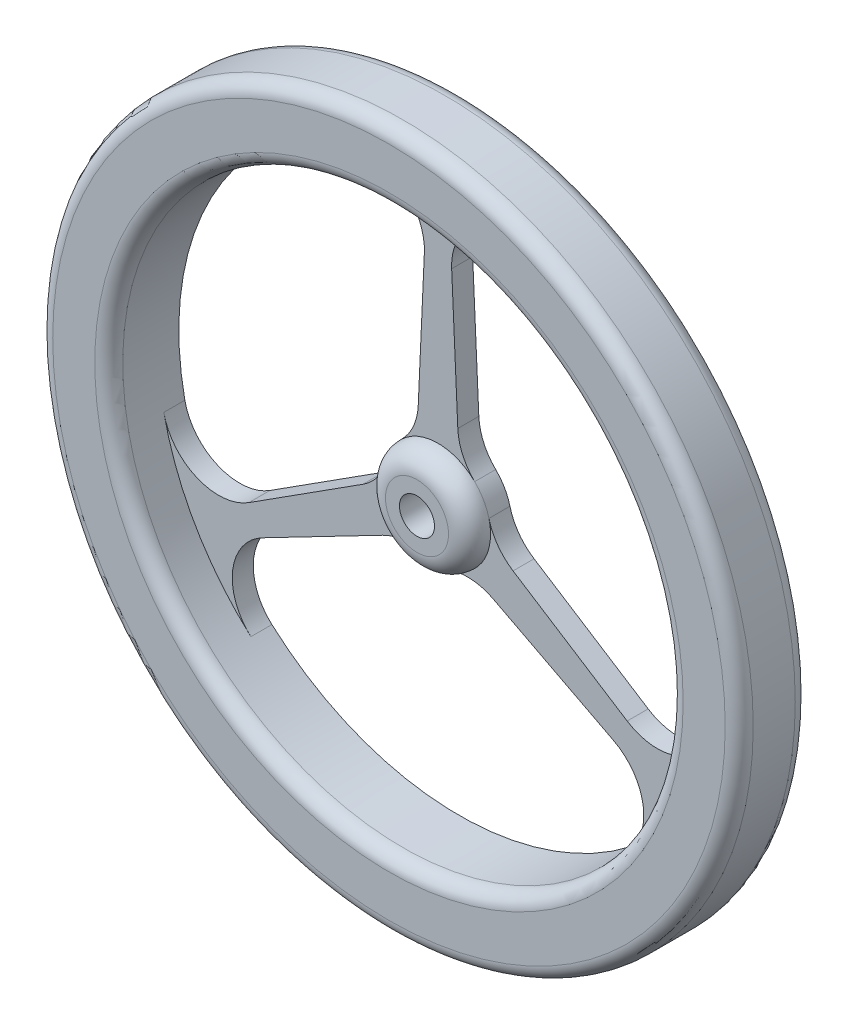
from build123d import *

# Parameters (mm, degrees)
SKETCH1_R           = 50
SKETCH1_R_2         = 40
EXTRUDE_THIN1_DEPTH = 10
SKETCH2_R           = 7.5
SKETCH2_R_2         = 2.5
BOSS_EXTRUDE1_DEPTH = 6
BOSS_EXTRUDE4_DEPTH = 3
FILLET4_R           = 8
FILLET2_R           = 3
FILLET3_R           = 2


# Some blends are built 0.0001 mm under size
with BuildPart() as part:
    # Sketch1 → Extrude-Thin1 (new body)
    with BuildSketch(Plane.XY):
        Circle(SKETCH1_R)
        Circle(SKETCH1_R_2, mode=Mode.SUBTRACT)
    extrude(amount=EXTRUDE_THIN1_DEPTH)



with BuildPart() as body_2:
    # Sketch2 → Boss-Extrude1 (new body)
    with BuildSketch(Plane.XY):
        Circle(SKETCH2_R)
        Circle(SKETCH2_R_2, mode=Mode.SUBTRACT)
    extrude(amount=BOSS_EXTRUDE1_DEPTH)


with BuildPart() as part_1:
    add(part.part)

    add(body_2.part)  # Boss-Extrude4 merges body 2
    # Sketch3 → Boss-Extrude4 (add)
    with BuildSketch(Plane.XY):
        with BuildLine():
            ThreePointArc((-3, 6.873863542), (-1.532322328, 7.341797347), (0, 7.5))
            Line((0, 7.5), (0, 40))
            ThreePointArc((0, 40), (-0.75, 39.992968132), (-1.499736305, 39.971875))
            Line((-1.499736305, 39.971875), (-3, 6.873863542))
        make_face()
        with BuildLine():
            Line((0, 40), (0, 7.5))
            ThreePointArc((0, 7.5), (1.532322328, 7.341797347), (3, 6.873863542))
            Line((3, 6.873863542), (1.499736305, 39.971875))
            ThreePointArc((1.499736305, 39.971875), (0.75, 39.992968132), (0, 40))
        make_face()
        with BuildLine():
            Line((4.45294045, -6.035007983), (33.866791034, -21.284747239))
            ThreePointArc((33.866791034, -21.284747239), (34.641016151, -20), (35.366527339, -18.687127761))
            Line((35.366527339, -18.687127761), (7.45294045, -0.83885556))
            ThreePointArc((7.45294045, -0.83885556), (6.495190528, -3.75), (4.45294045, -6.035007983))
        make_face()
        with BuildLine():
            ThreePointArc((-35.366527339, -18.687127761), (-34.641016151, -20), (-33.866791034, -21.284747239))
            Line((-33.866791034, -21.284747239), (-4.45294045, -6.035007983))
            ThreePointArc((-4.45294045, -6.035007983), (-6.495190528, -3.75), (-7.45294045, -0.83885556))
            Line((-7.45294045, -0.83885556), (-35.366527339, -18.687127761))
        make_face()
    extrude(amount=BOSS_EXTRUDE4_DEPTH)

    # Fillet4
    # the kernel refuses this fillet: 8 mm, written as the material it adds along each edge
    with BuildSketch(Plane(origin=(-3, 6.873863542, 0), x_dir=(-0.829854636614874, -0.5579796430774114, 0), z_dir=(0, 0, 1)), Plane(origin=(7.45294045, -0.83885556, 0), x_dir=(-0.06829722739215581, 0.9976650182954919, 0), z_dir=(0, 0, 1)), Plane(origin=(-4.45294045, -6.035007983, 0), x_dir=(0.8981518640070405, -0.43968537521809675, 0), z_dir=(0, 0, 1))) as fillet4_piece_1:
        with BuildLine():
            CenterArc((4.127463516, -7.870129559), FILLET4_R, 100.338012957, 43.150474146)
            Line((-2.302435059, -3.110255158), (0, 0))
            ThreePointArc((0, 0), (1.345912016, -0.121753539), (2.691824032, 0))
        make_face()
    extrude(amount=3)
    with BuildSketch(Plane(origin=(3, 6.873863542, 0), x_dir=(0.8298546366148741, -0.5579796430774113, 0), z_dir=(0, 0, 1)), Plane(origin=(4.45294045, -6.035007983, 0), x_dir=(-0.8981518640070573, -0.4396853752180626, 0), z_dir=(0, 0, 1)), Plane(origin=(-7.45294045, -0.83885556, 0), x_dir=(0.06829722739219261, 0.9976650182954894, 0), z_dir=(0, 0, 1))) as fillet4_piece_2:
        with BuildLine():
            CenterArc((4.127463516, 7.870129559), FILLET4_R, 216.511512897, 43.150474146)
            Line((-2.302435059, 3.110255158), (0, 0))
            ThreePointArc((0, 0), (1.345912016, 0.121753539), (2.691824032, 0))
        make_face()
    extrude(amount=3)
    with BuildSketch(Plane(origin=(1.499736305, 39.971875, 0), x_dir=(0.04528141614846467, -0.9989742706154096, 0), z_dir=(0, 0, 1)), Plane(origin=(33.866791034, -21.284747239, 0), x_dir=(-0.8877778041541985, 0.46027227860381686, 0), z_dir=(0, 0, 1)), Plane(origin=(-35.366527339, -18.687127761, 0), x_dir=(0.8424963880057403, 0.5387019920116138, 0), z_dir=(0, 0, 1))) as fillet4_piece_3:
        with BuildLine():
            CenterArc((9.927616813, 8), FILLET4_R, 159.305768692, 110.694231308)
            ThreePointArc((2.443779894, 10.827045272), (0.84452181, 5.49869866), (0, 0))
            Line((0, 0), (9.927616813, 0))
        make_face()
    extrude(amount=3)
    with BuildSketch(Plane(origin=(-1.499736305, 39.971875, 0), x_dir=(-0.04528141614846486, -0.9989742706154096, 0), z_dir=(0, 0, 1)), Plane(origin=(35.366527339, -18.687127761, 0), x_dir=(-0.8424963880057321, 0.5387019920116268, 0), z_dir=(0, 0, 1)), Plane(origin=(-33.866791034, -21.284747239, 0), x_dir=(0.8877778041542049, 0.4602722786038045, 0), z_dir=(0, 0, 1))) as fillet4_piece_4:
        with BuildLine():
            CenterArc((9.927616813, -8), FILLET4_R, 90, 110.694231308)
            ThreePointArc((2.443779894, -10.827045272), (0.84452181, -5.49869866), (0, 0))
            Line((0, 0), (9.927616813, 0))
        make_face()
    extrude(amount=3)

    # Fillet2
    fillet2_edges = [part_1.edges().sort_by_distance(p)[0] for p in [
        (-7.5, 0, 6),
    ]]
    fillet(fillet2_edges, radius=FILLET2_R - 0.0001)  # a hair under: the kernel refuses the full size

    # Fillet3
    fillet3_edges = [part_1.edges().sort_by_distance(p)[0] for p in [
        (-50, 0, 0),
        (-50, 0, 10),
        (-40, 0, 10),
    ]]
    fillet(fillet3_edges, radius=FILLET3_R)


solid = part_1.part
